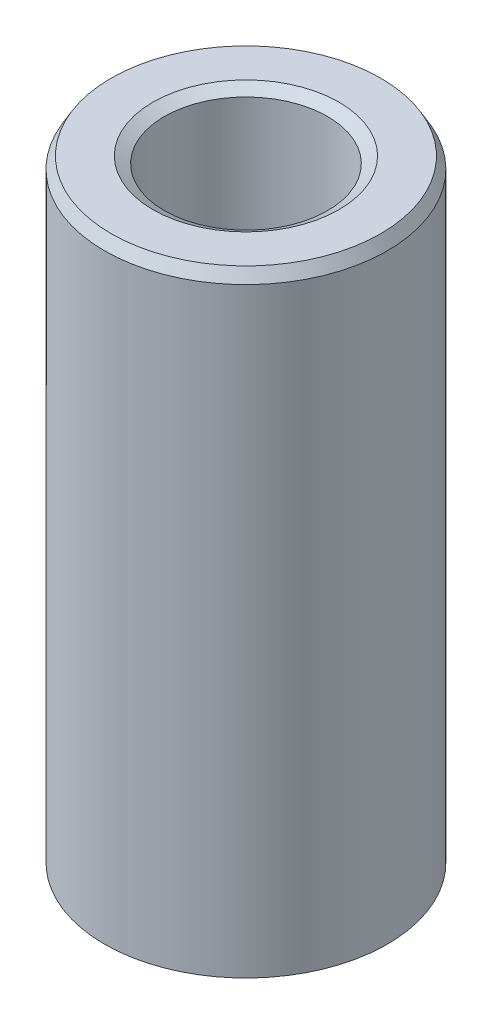
from build123d import *
from OCP.BRepFilletAPI import BRepFilletAPI_MakeChamfer

# Parameters (mm, degrees)
SKETCH1_R           = 45
BOSS_EXTRUDE1_DEPTH = 196.901496752
SKETCH2_R           = 25.969985823
CUT_EXTRUDE1_DEPTH  = 207.930421696
CHAMFER1_SIZE       = 3.660515985
CHAMFER1_SIZE2      = 2.113399889


with BuildPart() as part:
    # Sketch1 → Boss-Extrude1 (new body)
    with BuildSketch(Plane(origin=(0, 0, 0), x_dir=(1, 0, 0), z_dir=(0, 1, 0))):
        Circle(SKETCH1_R)
    extrude(amount=BOSS_EXTRUDE1_DEPTH)

    # Sketch2 → Cut-Extrude1 (cut, through all)
    with BuildSketch(Plane(origin=(0, 0, 0), x_dir=(1, 0, 0), z_dir=(0, 1, 0))):
        Circle(SKETCH2_R)
    extrude(amount=CUT_EXTRUDE1_DEPTH, mode=Mode.SUBTRACT)

    # Chamfer1: one chamfer whose edges measure the first distance from different faces: ONE call of the kernel's chamfer builder (chamfer() names one face for all edges)
    chamfer1_edges_1 = [part.edges().sort_by_distance(p)[0] for p in [
        (-25.969985823, 196.901496752, 0),
    ]]
    chamfer1_side_1 = [part.faces().sort_by_distance(p)[0] for p in [
        (-43.727207794, 196.901496752, 0),
    ]]
    chamfer1_edges_2 = [part.edges().sort_by_distance(p)[0] for p in [
        (-25.969985823, 0, 0),
    ]]
    chamfer1_side_2 = [part.faces().sort_by_distance(p)[0] for p in [
        (-25.969985823, 98.450748376, 0),
    ]]
    chamfer1_edges_3 = [part.edges().sort_by_distance(p)[0] for p in [
        (-45, 0, 0),
    ]]
    chamfer1_side_3 = [part.faces().sort_by_distance(p)[0] for p in [
        (-43.727207794, 0, 0),
    ]]
    chamfer1_edges_4 = [part.edges().sort_by_distance(p)[0] for p in [
        (-45, 196.901496752, 0),
    ]]
    chamfer1_side_4 = [part.faces().sort_by_distance(p)[0] for p in [
        (-45, 98.450748376, 0),
    ]]
    chamfer1 = BRepFilletAPI_MakeChamfer(part.part.solid().wrapped)
    for e in chamfer1_edges_1:
        chamfer1.Add(CHAMFER1_SIZE, CHAMFER1_SIZE2, e.wrapped, chamfer1_side_1[0].wrapped)  # the first distance lies on this face
    for e in chamfer1_edges_2:
        chamfer1.Add(CHAMFER1_SIZE, CHAMFER1_SIZE2, e.wrapped, chamfer1_side_2[0].wrapped)  # the first distance lies on this face
    for e in chamfer1_edges_3:
        chamfer1.Add(CHAMFER1_SIZE, CHAMFER1_SIZE2, e.wrapped, chamfer1_side_3[0].wrapped)  # the first distance lies on this face
    for e in chamfer1_edges_4:
        chamfer1.Add(CHAMFER1_SIZE, CHAMFER1_SIZE2, e.wrapped, chamfer1_side_4[0].wrapped)  # the first distance lies on this face
    add(Compound.cast(chamfer1.Shape()), mode=Mode.REPLACE)


solid = part.part
